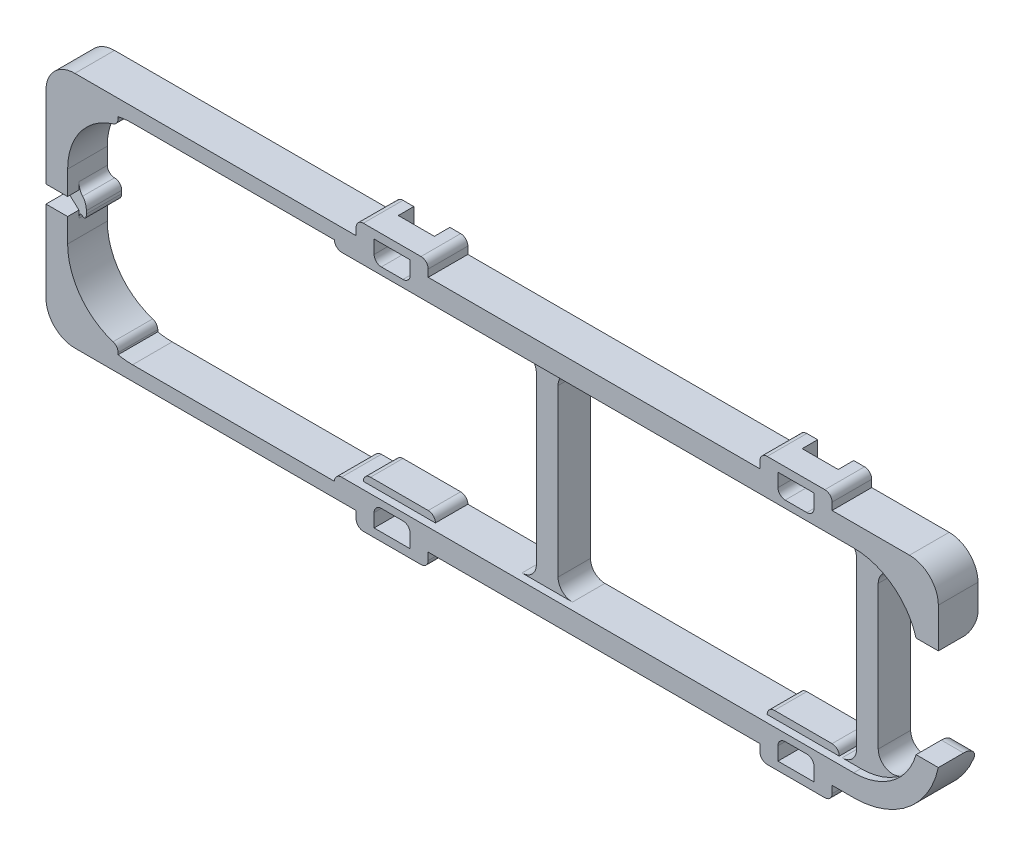
from build123d import *

# Parameters (mm, degrees)
BOSS_EXTRUDE2_DEPTH                        = 5.5
SKETCH4_W                                  = 3
SKETCH4_H                                  = 27
BOSS_EXTRUDE4_CROSS_STRUCTURES_DEPTH       = 5.5
SKETCH6_W                                  = 3
SKETCH6_H                                  = 27
CUT_EXTRUDE3_1_MM_SPACING_DEPTH            = 1
CUT_EXTRUDE4_ELECTRONICS_SPACING_DEPTH     = 124.233518168
SKETCH8_W                                  = 5.5
SKETCH8_H                                  = 14
CUT_EXTRUDE2_USB_C_CUTOUT_DEPTH            = 5
SKETCH10_W                                 = 2
SKETCH10_H                                 = 2.4
BOSS_EXTRUDE3_DEPTH                        = 5.5
CUT_EXTRUDE1_LED_OPENING_DEPTH             = 1.2
SKETCH12_W                                 = 10
SKETCH12_H                                 = 2
BOSS_EXTRUDE4_SNAP_BUMPS_DEPTH             = 5.5
SKETCH13_W                                 = 5
SKETCH13_H                                 = 4
CUT_EXTRUDE2_SNAP_SEAT_2_15_ORIGINAL_DEPTH = 2.15
SKETCH14_W                                 = 5
SKETCH14_H                                 = 2.85
CUT_EXTRUDE3_SNAP_POST_CUT_DEPTH           = 124.179930633
SKETCH15_W                                 = 10
SKETCH15_H                                 = 1
BOSS_EXTRUDE4_DEPTH                        = 4.5
FILLET3_R                                  = 1
FILLET4_R                                  = 1
FILLET5_R                                  = 2
FILLET6_SNAP_FEATURES_R                    = 1
BOSS_EXTRUDE7_DEPTH                        = 5.5
FILLET7_R                                  = 4
FILLET8_R                                  = 2


with BuildPart() as part:
    # Sketch3 → Boss-Extrude2 (new body)
    with BuildSketch(Plane.XY.offset(-1.6194024)):
        with BuildLine():
            Line((110, 16.5), (10, 16.5))
            ThreePointArc((10, 16.5), (1.514718626, 12.985281374), (-2, 4.5))
            Line((-2, 4.5), (-2, -4.5))
            ThreePointArc((-2, -4.5), (1.514718626, -12.985281374), (10, -16.5))
            Line((10, -16.5), (110, -16.5))
            ThreePointArc((110, -16.5), (118.485281374, -12.985281374), (122, -4.5))
            Line((122, -4.5), (122, 4.5))
            ThreePointArc((122, 4.5), (118.485281374, 12.985281374), (110, 16.5))
        make_face()
        with BuildLine():
            Line((119, -4.5), (119, 4.5))
            ThreePointArc((119, 4.5), (116.363961031, 10.863961031), (110, 13.5))
            Line((110, 13.5), (10, 13.5))
            ThreePointArc((10, 13.5), (3.636038969, 10.863961031), (1, 4.5))
            Line((1, 4.5), (1, -4.5))
            ThreePointArc((1, -4.5), (3.636038969, -10.863961031), (10, -13.5))
            Line((10, -13.5), (110, -13.5))
            ThreePointArc((110, -13.5), (116.363961031, -10.863961031), (119, -4.5))
        make_face(mode=Mode.SUBTRACT)
    extrude(amount=-BOSS_EXTRUDE2_DEPTH)

    # Sketch4 → Boss-Extrude4 - cross structures (add)
    with BuildSketch(Plane.XY.offset(-1.6194024)):
        with Locations((110.9, 0)):
            Rectangle(SKETCH4_W, SKETCH4_H)
        with Locations((66.5, 0)):
            Rectangle(SKETCH4_W, SKETCH4_H)
    extrude(amount=-BOSS_EXTRUDE4_CROSS_STRUCTURES_DEPTH)

    # Sketch6 → Cut-Extrude3 - 1 mm spacing (cut)
    with BuildSketch(Plane.XY.offset(-1.6194024)):
        with BuildLine():
            Line((109.4, 13.5), (110, 13.5))
            ThreePointArc((110, 13.5), (111.211013131, 13.418152678), (112.4, 13.174099377))
            Line((112.4, 13.174099377), (112.4, -13.174099377))
            ThreePointArc((112.4, -13.174099377), (111.211013131, -13.418152678), (110, -13.5))
            Line((110, -13.5), (109.4, -13.5))
            Line((109.4, -13.5), (109.4, 13.5))
        make_face()
        with Locations((66.5, 0)):
            Rectangle(SKETCH6_W, SKETCH6_H)
    extrude(amount=-CUT_EXTRUDE3_1_MM_SPACING_DEPTH, mode=Mode.SUBTRACT)

    # Sketch7 → Cut-Extrude4 - electronics spacing (cut, through all)
    with BuildSketch(Plane.XY.offset(-1.6194024)):
        with BuildLine():
            Line((38, -14.5), (10, -14.5))
            ThreePointArc((10, -14.5), (8.99491038, -14.44936153), (8, -14.297958971))
            Line((8, -14.297958971), (8, 14.297958971))
            ThreePointArc((8, 14.297958971), (8.99491038, 14.44936153), (10, 14.5))
            Line((10, 14.5), (38, 14.5))
            Line((38, 14.5), (38, -14.5))
        make_face()
    extrude(amount=-CUT_EXTRUDE4_ELECTRONICS_SPACING_DEPTH, mode=Mode.SUBTRACT)

    # Sketch8 → Cut-Extrude2 - USB-C cutout (cut)
    with BuildSketch(Plane(origin=(122, 0, 0), x_dir=(0, 0, -1), z_dir=(1, 0, 0))):
        with Locations((4.3694024, 0)):
            Rectangle(SKETCH8_W, SKETCH8_H)
    extrude(amount=-CUT_EXTRUDE2_USB_C_CUTOUT_DEPTH, mode=Mode.SUBTRACT)

    # Sketch10 → Boss-Extrude3 (add)
    with BuildSketch(Plane.XY.offset(-1.6194024)):
        with Locations((2, 0)):
            Rectangle(SKETCH10_W, SKETCH10_H)
    extrude(amount=-BOSS_EXTRUDE3_DEPTH)

    # Sketch11 → Cut-Extrude1 - LED opening (cut, symmetric)
    with BuildSketch(Plane(origin=(0, 0, 0), x_dir=(1, 0, 0), z_dir=(0, 1, 0))):
        Polygon((3, 2.2194024), (-2, 4.6194024), (-2, 1.6194024), (3, 1.6194024), align=None)
    extrude(amount=CUT_EXTRUDE1_LED_OPENING_DEPTH, both=True, mode=Mode.SUBTRACT)

    # Sketch12 → Boss-Extrude4 - snap bumps (add)
    with BuildSketch(Plane(origin=(0, 0, -7.1194024), x_dir=(-1, 0, 0), z_dir=(0, 0, -1))):
        with Locations((-46, -17.5)):
            Rectangle(SKETCH12_W, SKETCH12_H)
        with Locations((-102, -17.5)):
            Rectangle(SKETCH12_W, SKETCH12_H)
    boss_extrude4_snap_bumps = extrude(amount=-BOSS_EXTRUDE4_SNAP_BUMPS_DEPTH)

    # Sketch13 → Cut-Extrude2 - snap seat (2.15, original is 2.0) (cut)
    with BuildSketch(Plane(origin=(0, 0, -7.1194024), x_dir=(-1, 0, 0), z_dir=(0, 0, -1))):
        with Locations((-46, -16.5)):
            Rectangle(SKETCH13_W, SKETCH13_H)
        with Locations((-102, -16.5)):
            Rectangle(SKETCH13_W, SKETCH13_H)
    cut_extrude2_snap_seat_2_15_original = extrude(amount=-CUT_EXTRUDE2_SNAP_SEAT_2_15_ORIGINAL_DEPTH, mode=Mode.SUBTRACT)

    # Sketch14 → Cut-Extrude3 - snap post cut (cut, through all)
    with BuildSketch(Plane(origin=(0, 0, -4.9694024), x_dir=(-1, 0, 0), z_dir=(0, 0, -1))):
        with Locations((-46, -15.925)):
            Rectangle(SKETCH14_W, SKETCH14_H)
        with Locations((-102, -15.925)):
            Rectangle(SKETCH14_W, SKETCH14_H)
    cut_extrude3_snap_post_cut = extrude(amount=-CUT_EXTRUDE3_SNAP_POST_CUT_DEPTH, mode=Mode.SUBTRACT)

    # Sketch15 → Boss-Extrude4 (add)
    with BuildSketch(Plane(origin=(0, 0, -7.1194024), x_dir=(-1, 0, 0), z_dir=(0, 0, -1))):
        with Locations((-46, -13)):
            Rectangle(SKETCH15_W, SKETCH15_H)
        with Locations((-102, -13)):
            Rectangle(SKETCH15_W, SKETCH15_H)
    boss_extrude4 = extrude(amount=-BOSS_EXTRUDE4_DEPTH)

    # Mirror1: Boss-Extrude4 - snap bumps, Cut-Extrude2 - snap seat (2.15, original is 2.0), Cut-Extrude3 - snap post cut, Boss-Extrude4 across plane
    add(boss_extrude4_snap_bumps.mirror(Plane.ZX))
    add(cut_extrude2_snap_seat_2_15_original.mirror(Plane.ZX), mode=Mode.SUBTRACT)
    add(cut_extrude3_snap_post_cut.mirror(Plane.ZX), mode=Mode.SUBTRACT)
    add(boss_extrude4.mirror(Plane.ZX))

    # Fillet3
    fillet3_edges = [part.edges().sort_by_distance(p)[0] for p in [
        (38, 13.5, -4.3694024),
        (38, -13.5, -4.3694024),
        (8, -13.274964387, -4.3694024),
        (8, 13.274964387, -4.3694024),
    ]]
    fillet(fillet3_edges, radius=FILLET3_R - 0.0001)  # a hair under: the kernel refuses the full size

    # Fillet4
    fillet4_edges = [part.edges().sort_by_distance(p)[0] for p in [
        (1, 1.2, -5.1494024),
        (3, 1.2, -4.6694024),
        (3, -1.2, -4.6694024),
        (1, -1.2, -5.1494024),
    ]]
    fillet(fillet4_edges, radius=FILLET4_R - 0.0001)  # a hair under: the kernel refuses the full size

    # Fillet5
    fillet5_edges = [part.edges().sort_by_distance(p)[0] for p in [
        (112.4, -13.174099377, -4.8694024),
        (109.4, -13.5, -4.8694024),
        (109.4, 13.5, -4.8694024),
        (65, -13.5, -4.8694024),
        (65, 13.5, -4.8694024),
        (68, 13.5, -4.8694024),
        (68, -13.5, -4.8694024),
        (112.4, 13.174099377, -4.8694024),
    ]]
    fillet(fillet5_edges, radius=FILLET5_R)

    # Fillet6 - snap features
    fillet6_snap_features_edges = [part.edges().sort_by_distance(p)[0] for p in [
        (51, -18.5, -4.3694024),
        (41, -18.5, -4.3694024),
        (107, -18.5, -4.3694024),
        (97, -18.5, -4.3694024),
        (43.5, -14.5, -4.3694024),
        (48.5, -14.5, -4.3694024),
        (99.5, -14.5, -4.3694024),
        (104.5, -14.5, -4.3694024),
        (51, -12.5, -4.8694024),
        (41, -12.5, -4.8694024),
        (107, -12.5, -4.8694024),
        (97, -12.5, -4.8694024),
        (41, 18.5, -4.3694024),
        (51, 18.5, -4.3694024),
        (97, 18.5, -4.3694024),
        (107, 18.5, -4.3694024),
        (43.5, 14.5, -4.3694024),
        (48.5, 14.5, -4.3694024),
        (99.5, 14.5, -4.3694024),
        (104.5, 14.5, -4.3694024),
        (41, 12.5, -4.8694024),
        (51, 12.5, -4.8694024),
        (97, 12.5, -4.8694024),
        (107, 12.5, -4.8694024),
    ]]
    fillet(fillet6_snap_features_edges, radius=FILLET6_SNAP_FEATURES_R - 0.0001)  # a hair under: the kernel refuses the full size

    # Sketch18 → Boss-Extrude7 (add)
    with BuildSketch(Plane.XY.offset(-1.6194024)):
        with BuildLine():
            Line((110, 16.5), (121.736694594, 16.5))
            Line((121.736694594, 16.5), (121.736694594, 7))
            ThreePointArc((121.736694594, 7), (117.549834435, 13.827379053), (110, 16.5))
        make_face()
        with BuildLine():
            Line((-2, 4.5), (-2, 16.5))
            Line((-2, 16.5), (10, 16.5))
            ThreePointArc((10, 16.5), (1.514718626, 12.985281374), (-2, 4.5))
        make_face()
        with BuildLine():
            Line((-2, -4.5), (-2, -16.5))
            Line((-2, -16.5), (10, -16.5))
            ThreePointArc((10, -16.5), (1.514718626, -12.985281374), (-2, -4.5))
        make_face()
    extrude(amount=-BOSS_EXTRUDE7_DEPTH)

    # Fillet7
    fillet7_edges = [part.edges().sort_by_distance(p)[0] for p in [
        (121.736694594, 16.5, -4.3694024),
        (-2, 16.5, -4.3694024),
        (-2, -16.5, -4.3694024),
    ]]
    fillet(fillet7_edges, radius=FILLET7_R)

    # Fillet8
    fillet8_edges = [part.edges().sort_by_distance(p)[0] for p in [
        (120.191251414, 7, -7.1194024),
        (120.191251414, -7, -7.1194024),
    ]]
    fillet(fillet8_edges, radius=FILLET8_R)


solid = part.part
